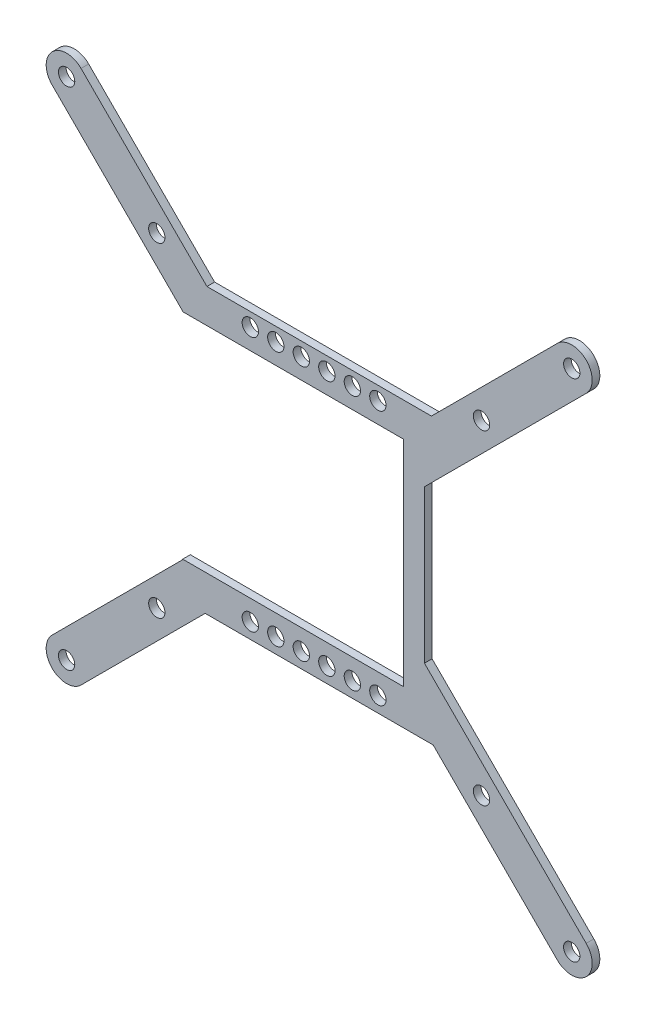
from build123d import *

# Parameters (mm, degrees)
CUT_EXTRUDE1_START       = -1.5
CUT_EXTRUDE1_OUTLINE_R   = 1.6
CUT_EXTRUDE1_DEPTH       = 1.5
CUT_EXTRUDE1_2_OUTLINE_R = 1.6
CUT_EXTRUDE1_2_DEPTH     = 1.5
CUT_EXTRUDE1_3_OUTLINE_R = 1.6
CUT_EXTRUDE1_3_DEPTH     = 1.5
BOSS_EXTRUDE1_DEPTH      = 1.5
BOSS_EXTRUDE2_DEPTH      = 1.5
BOSS_EXTRUDE3_START      = -1.5
SKETCH4_W                = 8
SKETCH4_H                = 34
SKETCH4_R                = 1.6
BOSS_EXTRUDE3_DEPTH      = 1.5
CUT_EXTRUDE2_DEPTH       = 10
SKETCH6_R                = 1.6
CUT_EXTRUDE3_DEPTH       = 10
CUT_EXTRUDE4_DEPTH       = 10
SKETCH8_R                = 1.6
CUT_EXTRUDE6_DEPTH       = 10
BOSS_EXTRUDE4_DEPTH      = 1.5
SKETCH10_W               = 3.5
SKETCH10_H               = 42
CUT_EXTRUDE7_DEPTH       = 10
CUT_EXTRUDE8_START       = -10
SKETCH11_R               = 1.6
CUT_EXTRUDE8_DEPTH       = 10
BOSS_EXTRUDE5_DEPTH      = 1.5
SKETCH13_R               = 1.6
BOSS_EXTRUDE6_DEPTH      = 1.5
SKETCH14_R               = 1.6
CUT_EXTRUDE9_DEPTH       = 10
BOSS_EXTRUDE7_DEPTH      = 1.5
SKETCH16_R               = 1.6
CUT_EXTRUDE10_DEPTH      = 10
SKETCH17_R               = 1.6
BOSS_EXTRUDE8_DEPTH      = 1.5
SKETCH18_R               = 1.6
CUT_EXTRUDE11_DEPTH      = 10
CUT_EXTRUDE12_START      = -2
CUT_EXTRUDE12_OUTLINE_R  = 1.6
CUT_EXTRUDE12_DEPTH      = 3
SKETCH20_R               = 1.6
BOSS_EXTRUDE9_DEPTH      = 1.5
SKETCH21_R               = 1.6
BOSS_EXTRUDE10_DEPTH     = 1.5
SKETCH22_R               = 89.618816207
CUT_EXTRUDE13_DEPTH      = 10
SKETCH23_R               = 1.6
BOSS_EXTRUDE11_DEPTH     = 1.5


with BuildPart() as part:
    # Cut-Extrude1: read off the stored shape, not the designer's step
    # Cut-Extrude1 outline → Cut-Extrude1 (new body)
    with BuildSketch(Plane.XY.offset(1.5).offset(CUT_EXTRUDE1_START)):
        with BuildLine():
            ThreePointArc((-32.828427125, -27.171572875), (-32.828427125, -32.828427125), (-27.171572875, -32.828427125))
            Line((-27.171572875, -32.828427125), (-15.343145751, -21))
            Line((-15.343145751, -21), (-28, -21))
            Line((-28, -21), (-28, -22.246575342))
            Line((-28, -22.246575342), (-32.876712329, -27.123287671))
            Line((-32.876712329, -27.123287671), (-32.828427125, -27.171572875))
        make_face()
        with Locations((-30, -30)):
            Circle(CUT_EXTRUDE1_OUTLINE_R, mode=Mode.SUBTRACT)
    extrude(amount=CUT_EXTRUDE1_DEPTH)



with BuildPart() as body_2:
    # Cut-Extrude1 2 outline → Cut-Extrude1 2 (new body)
    with BuildSketch(Plane.XY.offset(1.5).offset(CUT_EXTRUDE1_START)):
        with BuildLine():
            Line((21, 31.740068927), (21, -13))
            Line((21, -13), (13, -13))
            Line((13, -13), (13, -20))
            Line((13, -20), (14.343145751, -20))
            Line((14.343145751, -20), (27.171572875, -32.828427125))
            ThreePointArc((27.171572875, -32.828427125), (32.828427125, -32.828427125), (32.828427125, -27.171572875))
            Line((32.828427125, -27.171572875), (28, -22.343145751))
            Line((28, -22.343145751), (28, 27.653870467))
            Line((28, 27.653870467), (36.085493114, 37.454468181))
            ThreePointArc((36.085493114, 37.454468181), (35.545531819, 43.085493114), (29.914506886, 42.545531819))
            Line((29.914506886, 42.545531819), (21, 31.740068927))
        make_face()
        with Locations((30, -30)):
            Circle(CUT_EXTRUDE1_2_OUTLINE_R, mode=Mode.SUBTRACT)
        with Locations((25, -6.5)):
            Circle(CUT_EXTRUDE1_2_OUTLINE_R, mode=Mode.SUBTRACT)
        with Locations((25, -1.5)):
            Circle(CUT_EXTRUDE1_2_OUTLINE_R, mode=Mode.SUBTRACT)
        with Locations((25, 3.5)):
            Circle(CUT_EXTRUDE1_2_OUTLINE_R, mode=Mode.SUBTRACT)
        with Locations((25, 8.5)):
            Circle(CUT_EXTRUDE1_2_OUTLINE_R, mode=Mode.SUBTRACT)
        with Locations((25, 13.5)):
            Circle(CUT_EXTRUDE1_2_OUTLINE_R, mode=Mode.SUBTRACT)
        with Locations((33, 40)):
            Circle(CUT_EXTRUDE1_2_OUTLINE_R, mode=Mode.SUBTRACT)
    extrude(amount=CUT_EXTRUDE1_2_DEPTH)



with BuildPart() as body_3:
    # Cut-Extrude1 3 outline → Cut-Extrude1 3 (new body)
    with BuildSketch(Plane.XY.offset(1.5).offset(CUT_EXTRUDE1_START)):
        with BuildLine():
            Line((-28, 21), (-21, 21))
            Line((-21, 21), (-21, 31.740068927))
            Line((-21, 31.740068927), (-29.914506886, 42.545531819))
            ThreePointArc((-29.914506886, 42.545531819), (-35.545531819, 43.085493114), (-36.085493114, 37.454468181))
            Line((-36.085493114, 37.454468181), (-28, 27.653870467))
            Line((-28, 27.653870467), (-28, 21))
        make_face()
        with Locations((-33, 40)):
            Circle(CUT_EXTRUDE1_3_OUTLINE_R, mode=Mode.SUBTRACT)
    extrude(amount=CUT_EXTRUDE1_3_DEPTH)


with BuildPart() as body_2_1:
    add(body_2.part)

    add(body_3.part)  # Boss-Extrude1 merges body 3
    # Sketch2 → Boss-Extrude1 (add)
    with BuildSketch(Plane.XY.offset(1.5)):
        Polygon((-21, 21), (21, 21), (21, 31.740068927), (17.62888627, 27.653870467), (-17.62888627, 27.653870467), (-21, 31.740068927), align=None)
    extrude(amount=-BOSS_EXTRUDE1_DEPTH)


with BuildPart() as part_1:
    add(part.part)

    add(body_2_1.part)  # Boss-Extrude2 merges body 2
    # Sketch3 → Boss-Extrude2 (add)
    with BuildSketch(Plane.XY.offset(1.5)):
        Polygon((-15.343145751, -21), (-22.343145751, -28), (22.343145751, -28), (15.343145751, -21), align=None)
    extrude(amount=-BOSS_EXTRUDE2_DEPTH)

    # Sketch4 → Boss-Extrude3 (add)
    with BuildSketch(Plane.XY.offset(1.5).offset(BOSS_EXTRUDE3_START)):
        Polygon((14.343145751, -20), (13, -20), (13, -21), (15.343145751, -21), align=None)
        with Locations((17, 4)):
            Rectangle(SKETCH4_W, SKETCH4_H)
        with Locations((25, -6.5)):
            Circle(SKETCH4_R)
        with Locations((25, -1.5)):
            Circle(SKETCH4_R)
        with Locations((25, 3.5)):
            Circle(SKETCH4_R)
        with Locations((25, 8.5)):
            Circle(SKETCH4_R)
        with Locations((25, 13.5)):
            Circle(SKETCH4_R)
    extrude(amount=BOSS_EXTRUDE3_DEPTH)

    # Sketch5 → Cut-Extrude2 (cut)
    with BuildSketch(Plane.XY.offset(1.5)):
        Polygon((28, 27.653870467), (17.62888627, 15.082823521), (17.62888627, -11.972032021), (28, -22.343145751), align=None)
    extrude(amount=-CUT_EXTRUDE2_DEPTH, mode=Mode.SUBTRACT)

    # Sketch6 → Cut-Extrude3 (cut)
    with BuildSketch(Plane.XY.offset(1.5)):
        with Locations((6.5, 25)):
            Circle(SKETCH6_R)
        with Locations((1.5, 25)):
            Circle(SKETCH6_R)
        with Locations((-3.5, 25)):
            Circle(SKETCH6_R)
        with Locations((-8.5, 25)):
            Circle(SKETCH6_R)
        with Locations((-13.5, 25)):
            Circle(SKETCH6_R)
        with Locations((-13.5, -25)):
            Circle(SKETCH6_R)
        with Locations((-8.5, -25)):
            Circle(SKETCH6_R)
        with Locations((-3.5, -25)):
            Circle(SKETCH6_R)
        with Locations((1.5, -25)):
            Circle(SKETCH6_R)
        with Locations((6.5, -25)):
            Circle(SKETCH6_R)
    extrude(amount=-CUT_EXTRUDE3_DEPTH, mode=Mode.SUBTRACT)

    # Sketch7 → Cut-Extrude4 (cut)
    with BuildSketch(Plane.XY.offset(1.5)):
        Polygon((-28, 27.653870467), (-19.973613934, 17.924917659), (-36.717571938, 15.874580857), align=None)
        Polygon((-28, -22.246575342), (-20.930672911, -15.177248254), (-29.189636074, -18.711911798), align=None)
    extrude(amount=-CUT_EXTRUDE4_DEPTH, mode=Mode.SUBTRACT)

    # Sketch8 → Cut-Extrude6 (cut)
    with BuildSketch(Plane.XY.offset(1.5)):
        with Locations((11.5, -25)):
            Circle(SKETCH8_R)
        with Locations((11.5, 25)):
            Circle(SKETCH8_R)
    extrude(amount=-CUT_EXTRUDE6_DEPTH, mode=Mode.SUBTRACT)

    # Sketch9 → Boss-Extrude4 (add)
    with BuildSketch(Plane.XY.offset(1.5)):
        Polygon((20.62888627, 1.55539575), (20.62888627, 18.719187158), (17.62888627, 15.082823521), (17.62888627, -11.972032021), (20.62888627, -14.972032021), align=None)
    extrude(amount=-BOSS_EXTRUDE4_DEPTH)

    # Sketch10 → Cut-Extrude7 (cut)
    with BuildSketch(Plane.XY.offset(1.5)):
        with Locations((14.75, 0)):
            Rectangle(SKETCH10_W, SKETCH10_H)
    extrude(amount=-CUT_EXTRUDE7_DEPTH, mode=Mode.SUBTRACT)

    # Sketch11 → Cut-Extrude8 (cut)
    # profile 1 of 4: a face of its own
    with BuildSketch(Plane.XY.offset(1.5).offset(CUT_EXTRUDE8_START)):
        with BuildLine():
            Line((20.62888627, 27.653870467), (20.62888627, 18.719187158))
            Line((20.62888627, 18.719187158), (36.085493114, 37.454468181))
            ThreePointArc((36.085493114, 37.454468181), (35.545531819, 43.085493114), (29.914506886, 42.545531819))
            Line((29.914506886, 42.545531819), (17.62888627, 27.653870467))
            Line((17.62888627, 27.653870467), (20.62888627, 27.653870467))
        make_face()
        with Locations((33, 40)):
            Circle(SKETCH11_R, mode=Mode.SUBTRACT)
    # profile 2 of 4: a face of its own
    with BuildSketch(Plane.XY.offset(1.5).offset(CUT_EXTRUDE8_START)):
        with BuildLine():
            Line((-36.085493114, 37.454468181), (-26.753424658, 26.142870052))
            Line((-26.753424658, 26.142870052), (-26.753424658, 27.653870467))
            Line((-26.753424658, 27.653870467), (-17.62888627, 27.653870467))
            Line((-17.62888627, 27.653870467), (-29.914506886, 42.545531819))
            ThreePointArc((-29.914506886, 42.545531819), (-35.545531819, 43.085493114), (-36.085493114, 37.454468181))
        make_face()
        with Locations((-33, 40)):
            Circle(SKETCH11_R, mode=Mode.SUBTRACT)
    # profile 3 of 4: a face of its own
    with BuildSketch(Plane.XY.offset(1.5).offset(CUT_EXTRUDE8_START)):
        with BuildLine():
            Line((-27.171572875, -32.828427125), (-22.343145751, -28))
            Line((-22.343145751, -28), (-26.753424658, -28))
            Line((-26.753424658, -28), (-26.753424658, -21))
            Line((-26.753424658, -21), (-32.876712329, -27.123287671))
            Line((-32.876712329, -27.123287671), (-32.828427125, -27.171572875))
            ThreePointArc((-32.828427125, -27.171572875), (-32.828427125, -32.828427125), (-27.171572875, -32.828427125))
        make_face()
        with Locations((-30, -30)):
            Circle(SKETCH11_R, mode=Mode.SUBTRACT)
    # profile 4 of 4: a face of its own
    with BuildSketch(Plane.XY.offset(1.5).offset(CUT_EXTRUDE8_START)):
        with BuildLine():
            Line((32.828427125, -27.171572875), (20.62888627, -14.972032021))
            Line((20.62888627, -14.972032021), (20.62888627, -28))
            Line((20.62888627, -28), (22.343145751, -28))
            Line((22.343145751, -28), (27.171572875, -32.828427125))
            ThreePointArc((27.171572875, -32.828427125), (32.828427125, -32.828427125), (32.828427125, -27.171572875))
        make_face()
        with Locations((30, -30)):
            Circle(SKETCH11_R, mode=Mode.SUBTRACT)
    extrude(amount=CUT_EXTRUDE8_DEPTH, mode=Mode.SUBTRACT)

    # Sketch12 → Boss-Extrude5 (add)
    with BuildSketch(Plane.XY.offset(1.5)):
        Polygon((-22.510556865, 21), (-26.753424658, 21), (-26.753424658, 26.142870052), align=None)
    extrude(amount=-BOSS_EXTRUDE5_DEPTH)

    # Sketch13 → Boss-Extrude6 (add)
    # profile 1 of 4: a face of its own
    with BuildSketch(Plane.XY.offset(1.5)):
        with BuildLine():
            Line((20.62888627, 26.28574052), (20.62888627, 14.972032021))
            Line((20.62888627, 14.972032021), (46.669047558, 41.012193309))
            ThreePointArc((46.669047558, 41.012193309), (46.669047558, 46.669047558), (41.012193309, 46.669047558))
            Line((41.012193309, 46.669047558), (20.62888627, 26.28574052))
        make_face()
    # profile 2 of 4: a face of its own
    with BuildSketch(Plane.XY.offset(1.5)):
        with BuildLine():
            Line((-46.669047558, 41.012193309), (-26.753424658, 21.096570408))
            Line((-26.753424658, 21.096570408), (-26.753424658, 27.653870467))
            Line((-26.753424658, 27.653870467), (-21.997016217, 27.653870467))
            Line((-21.997016217, 27.653870467), (-41.012193309, 46.669047558))
            ThreePointArc((-41.012193309, 46.669047558), (-46.669047558, 46.669047558), (-46.669047558, 41.012193309))
        make_face()
        with Locations((-43.840620434, 43.840620434)):
            Circle(SKETCH13_R, mode=Mode.SUBTRACT)
    # profile 3 of 4: a face of its own
    with BuildSketch(Plane.XY.offset(1.5)):
        with BuildLine():
            ThreePointArc((-46.669047558, -41.012193309), (-46.669047558, -46.669047558), (-41.012193309, -46.669047558))
            Line((-41.012193309, -46.669047558), (-22.343145751, -28))
            Line((-22.343145751, -28), (-26.753424658, -28))
            Line((-26.753424658, -28), (-26.753424658, -21.096570408))
            Line((-26.753424658, -21.096570408), (-46.669047558, -41.012193309))
        make_face()
        with Locations((-43.840620434, -43.840620434)):
            Circle(SKETCH13_R, mode=Mode.SUBTRACT)
    # profile 4 of 4: a face of its own
    with BuildSketch(Plane.XY.offset(1.5)):
        with BuildLine():
            Line((20.62888627, -26.28574052), (41.012193309, -46.669047558))
            ThreePointArc((41.012193309, -46.669047558), (46.669047558, -46.669047558), (46.669047558, -41.012193309))
            Line((46.669047558, -41.012193309), (20.62888627, -14.972032021))
            Line((20.62888627, -14.972032021), (20.62888627, -26.28574052))
        make_face()
        with Locations((43.840620434, -43.840620434)):
            Circle(SKETCH13_R, mode=Mode.SUBTRACT)
    extrude(amount=-BOSS_EXTRUDE6_DEPTH)

    # Sketch14 → Cut-Extrude9 (cut)
    with BuildSketch(Plane.XY.offset(1.5)):
        with Locations((43.840620434, 43.840620434)):
            Circle(SKETCH14_R)
    extrude(amount=-CUT_EXTRUDE9_DEPTH, mode=Mode.SUBTRACT)

    # Sketch15 → Boss-Extrude7 (add)
    with BuildSketch(Plane.XY.offset(1.5)):
        Polygon((20.62888627, -28), (22.343145751, -28), (22.343145751, -20.852318202), (17.520154223, -24.044979555), align=None)
        Polygon((20.62888627, 27.653870467), (24.477160925, 27.653870467), (19.074520247, 22.251229789), (17.520154223, 26.392880602), align=None)
    extrude(amount=-BOSS_EXTRUDE7_DEPTH)

    # Sketch16 → Cut-Extrude10 (cut)
    with BuildSketch(Plane.XY.offset(1.5)):
        with Locations((-31.819805153, 31.819805153)):
            Circle(SKETCH16_R)
        with Locations((31.819805153, 31.819805153)):
            Circle(SKETCH16_R)
        with Locations((31.819805153, -31.819805153)):
            Circle(SKETCH16_R)
        with Locations((-31.819805153, -31.819805153)):
            Circle(SKETCH16_R)
    extrude(amount=-CUT_EXTRUDE10_DEPTH, mode=Mode.SUBTRACT)

    # Sketch17 → Boss-Extrude8 (add)
    with BuildSketch(Plane.XY.offset(1.5)):
        with BuildLine():
            ThreePointArc((-31.819805153, 35.819805153), (-28.355703538, 33.819805153), (-28.355703538, 29.819805153))
            Line((-28.355703538, 29.819805153), (28.355703538, 29.819805153))
            ThreePointArc((28.355703538, 29.819805153), (28.355703538, 33.819805153), (31.819805153, 35.819805153))
            Line((31.819805153, 35.819805153), (-31.819805153, 35.819805153))
        make_face()
        with Locations((-8, 32.819805153)):
            Circle(SKETCH17_R, mode=Mode.SUBTRACT)
        with Locations((8, 32.819805153)):
            Circle(SKETCH17_R, mode=Mode.SUBTRACT)
    extrude(amount=-BOSS_EXTRUDE8_DEPTH)

    # Sketch18 → Cut-Extrude11 (cut)
    with BuildSketch(Plane.XY.offset(1.5)):
        with Locations((38.890872965, -38.890872965)):
            Circle(SKETCH18_R)
        with Locations((-38.890872965, -38.890872965)):
            Circle(SKETCH18_R)
        with Locations((38.890872965, 38.890872965)):
            Circle(SKETCH18_R)
        with Locations((-38.890872965, 38.890872965)):
            Circle(SKETCH18_R)
    extrude(amount=-CUT_EXTRUDE11_DEPTH, mode=Mode.SUBTRACT)

    # Cut-Extrude12: read off the stored shape, not the designer's step
    # Cut-Extrude12 outline → Cut-Extrude12 (cut)
    # profile 1 of 4: a face of its own
    with BuildSketch(Plane.XY.offset(1.5).offset(CUT_EXTRUDE12_START)):
        with BuildLine():
            Line((36.222978367, 41.879832617), (36.224492351, 41.872552763))
            ThreePointArc((36.224492351, 41.872552763), (41.797056095, 41.639345199), (41.71930009, 36.062445841))
            Line((41.71930009, 36.062445841), (46.669047558, 41.012193309))
            ThreePointArc((46.669047558, 41.012193309), (46.669047558, 46.669047558), (41.012193309, 46.669047558))
            Line((41.012193309, 46.669047558), (36.222978367, 41.879832617))
        make_face()
        with Locations((43.840620434, 43.840620434)):
            Circle(CUT_EXTRUDE12_OUTLINE_R, mode=Mode.SUBTRACT)
    # profile 2 of 4: a face of its own
    with BuildSketch(Plane.XY.offset(1.5).offset(CUT_EXTRUDE12_START)):
        with BuildLine():
            ThreePointArc((41.71930009, -36.062445841), (41.71930009, -41.71930009), (36.062445841, -41.71930009))
            Line((36.062445841, -41.71930009), (41.012193309, -46.669047558))
            ThreePointArc((41.012193309, -46.669047558), (46.669047558, -46.669047558), (46.669047558, -41.012193309))
            Line((46.669047558, -41.012193309), (41.71930009, -36.062445841))
        make_face()
        with Locations((43.840620434, -43.840620434)):
            Circle(CUT_EXTRUDE12_OUTLINE_R, mode=Mode.SUBTRACT)
    # profile 3 of 4: a face of its own
    with BuildSketch(Plane.XY.offset(1.5).offset(CUT_EXTRUDE12_START)):
        with BuildLine():
            ThreePointArc((-36.062445841, -41.71930009), (-41.550778866, -41.878330178), (-42.027335486, -36.408413931))
            Line((-42.027335486, -36.408413931), (-42.048509384, -36.391655135))
            Line((-42.048509384, -36.391655135), (-46.669047558, -41.012193309))
            ThreePointArc((-46.669047558, -41.012193309), (-46.669047558, -46.669047558), (-41.012193309, -46.669047558))
            Line((-41.012193309, -46.669047558), (-36.062445841, -41.71930009))
        make_face()
        with Locations((-43.840620434, -43.840620434)):
            Circle(CUT_EXTRUDE12_OUTLINE_R, mode=Mode.SUBTRACT)
    # profile 4 of 4: a face of its own
    with BuildSketch(Plane.XY.offset(1.5).offset(CUT_EXTRUDE12_START)):
        with BuildLine():
            ThreePointArc((-41.815610055, 36.162152944), (-41.66986379, 41.767887042), (-36.062445841, 41.71930009))
            Line((-36.062445841, 41.71930009), (-41.012193309, 46.669047558))
            ThreePointArc((-41.012193309, 46.669047558), (-46.669047558, 46.669047558), (-46.669047558, 41.012193309))
            Line((-46.669047558, 41.012193309), (-41.817773996, 36.160919747))
            Line((-41.817773996, 36.160919747), (-41.815610055, 36.162152944))
        make_face()
        with Locations((-43.840620434, 43.840620434)):
            Circle(CUT_EXTRUDE12_OUTLINE_R, mode=Mode.SUBTRACT)
    extrude(amount=CUT_EXTRUDE12_DEPTH, mode=Mode.SUBTRACT)

    # Sketch20 → Boss-Extrude9 (add)
    # profile 1 of 2: a face of its own
    with BuildSketch(Plane.XY.offset(1.5)):
        Polygon((-30.162950904, 35.819805153), (-24.162950904, 29.819805153), (24.162950904, 29.819805153), (30.162950904, 35.819805153), align=None)
        with Locations((-8, 32.819805153)):
            Circle(SKETCH20_R, mode=Mode.SUBTRACT)
        with Locations((8, 32.819805153)):
            Circle(SKETCH20_R, mode=Mode.SUBTRACT)
    # profile 2 of 2: a face of its own
    with BuildSketch(Plane.XY.offset(1.5)):
        Polygon((30.162950904, -35.819805153), (-30.162950904, -35.819805153), (-24.162950904, -29.819805153), (24.162950904, -29.819805153), align=None)
        with Locations((8, -32.819805153)):
            Circle(SKETCH20_R, mode=Mode.SUBTRACT)
        with Locations((-8, -32.819805153)):
            Circle(SKETCH20_R, mode=Mode.SUBTRACT)
    extrude(amount=-BOSS_EXTRUDE9_DEPTH)

    # Sketch21 → Boss-Extrude10 (add)
    with BuildSketch(Plane.XY.offset(1.5)):
        Polygon((24.162950904, 24.506096654), (24.162950904, -29.819805153), (30.162950904, -26.836364226), (30.162950904, 24.506096654), align=None)
        with Locations((27.162950904, 8)):
            Circle(SKETCH21_R, mode=Mode.SUBTRACT)
        with Locations((27.162950904, -8)):
            Circle(SKETCH21_R, mode=Mode.SUBTRACT)
    extrude(amount=-BOSS_EXTRUDE10_DEPTH)

    # Sketch22 → Cut-Extrude13 (cut)
    with BuildSketch(Plane.XY.offset(1.5)):
        Circle(SKETCH22_R)
        with BuildLine():
            Line((-24.162950904, -29.819805153), (-28.991378029, -34.648232278))
            ThreePointArc((-28.991378029, -34.648232278), (-34.648232278, -34.648232278), (-34.648232278, -28.991378029))
            Line((-34.648232278, -28.991378029), (-26.753424658, -21.096570408))
            Line((-26.753424658, -21.096570408), (-26.753424658, -21))
            Line((-26.753424658, -21), (-26.753424658, 21.096570408))
            Line((-26.753424658, 21.096570408), (-34.648232278, 28.991378029))
            ThreePointArc((-34.648232278, 28.991378029), (-34.648232278, 34.648232278), (-28.991378029, 34.648232278))
            Line((-28.991378029, 34.648232278), (-21.997016217, 27.653870467))
            Line((-21.997016217, 27.653870467), (21.997016217, 27.653870467))
            Line((21.997016217, 27.653870467), (28.991378029, 34.648232278))
            ThreePointArc((28.991378029, 34.648232278), (34.648232278, 34.648232278), (34.648232278, 28.991378029))
            Line((34.648232278, 28.991378029), (20.62888627, 14.972032021))
            Line((20.62888627, 14.972032021), (20.62888627, -14.972032021))
            Line((20.62888627, -14.972032021), (34.648232278, -28.991378029))
            ThreePointArc((34.648232278, -28.991378029), (34.648232278, -34.648232278), (28.991378029, -34.648232278))
            Line((28.991378029, -34.648232278), (24.162950904, -29.819805153))
            Line((24.162950904, -29.819805153), (-24.162950904, -29.819805153))
        make_face(mode=Mode.SUBTRACT)
    extrude(amount=-CUT_EXTRUDE13_DEPTH, mode=Mode.SUBTRACT)

    # Sketch23 → Boss-Extrude11 (add)
    # profile 1 of 4: a face of its own
    with BuildSketch(Plane.XY.offset(1.5)):
        with BuildLine():
            Line((46.669047558, -52.325901808), (28.991378029, -34.648232278))
            ThreePointArc((28.991378029, -34.648232278), (34.648232278, -34.648232278), (34.648232278, -28.991378029))
            Line((34.648232278, -28.991378029), (52.325901808, -46.669047558))
            ThreePointArc((52.325901808, -46.669047558), (52.325901808, -52.325901808), (46.669047558, -52.325901808))
        make_face()
        with Locations((49.497474683, -49.497474683)):
            Circle(SKETCH23_R, mode=Mode.SUBTRACT)
    # profile 2 of 4: a face of its own
    with BuildSketch(Plane.XY.offset(1.5)):
        with BuildLine():
            Line((28.991378029, 34.648232278), (46.669047558, 52.325901808))
            ThreePointArc((46.669047558, 52.325901808), (52.325901808, 52.325901808), (52.325901808, 46.669047558))
            Line((52.325901808, 46.669047558), (34.648232278, 28.991378029))
            ThreePointArc((34.648232278, 28.991378029), (34.648232278, 34.648232278), (28.991378029, 34.648232278))
        make_face()
        with Locations((49.497474683, 49.497474683)):
            Circle(SKETCH23_R, mode=Mode.SUBTRACT)
    # profile 3 of 4: a face of its own
    with BuildSketch(Plane.XY.offset(1.5)):
        with BuildLine():
            Line((-52.325901808, -46.669047558), (-34.648232278, -28.991378029))
            ThreePointArc((-34.648232278, -28.991378029), (-34.648232278, -34.648232278), (-28.991378029, -34.648232278))
            Line((-28.991378029, -34.648232278), (-46.669047558, -52.325901808))
            ThreePointArc((-46.669047558, -52.325901808), (-52.325901808, -52.325901808), (-52.325901808, -46.669047558))
        make_face()
        with Locations((-49.497474683, -49.497474683)):
            Circle(SKETCH23_R, mode=Mode.SUBTRACT)
    # profile 4 of 4: a face of its own
    with BuildSketch(Plane.XY.offset(1.5)):
        with BuildLine():
            Line((-46.669047558, 52.325901808), (-28.991378029, 34.648232278))
            ThreePointArc((-28.991378029, 34.648232278), (-34.648232278, 34.648232278), (-34.648232278, 28.991378029))
            Line((-34.648232278, 28.991378029), (-52.325901808, 46.669047558))
            ThreePointArc((-52.325901808, 46.669047558), (-52.325901808, 52.325901808), (-46.669047558, 52.325901808))
        make_face()
        with Locations((-49.497474683, 49.497474683)):
            Circle(SKETCH23_R, mode=Mode.SUBTRACT)
    extrude(amount=-BOSS_EXTRUDE11_DEPTH)


solid = part_1.part
